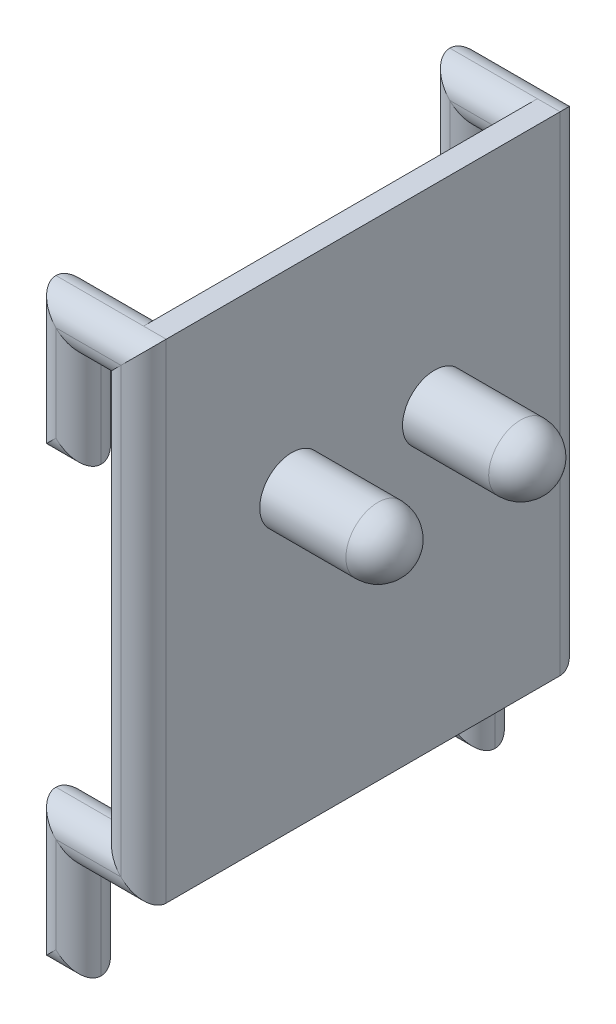
from build123d import *

# Parameters (mm, degrees)
EXTRU_MINCE1_DEPTH         = 2.3
CONG_1_R                   = 2.3
ESQUISSE2_W                = 40
ESQUISSE2_H                = 49.6
BOSS_EXTRU_1_DEPTH         = 2.3
R_P_TITION_LIN_AIRE1_COUNT = 2
R_P_TITION_LIN_AIRE1_PITCH = 40
CONG_2_R                   = 2.3
ESQUISSE3_R                = 3.25
BOSS_EXTRU_2_DEPTH         = 12
CONG_3_R                   = 3.25


with BuildPart() as part:
    # Esquisse1 → Extru.-Mince1 (new, symmetric)
    with BuildSketch(Plane.XY):
        Polygon((-4.3, -57), (-4.3, -47.3), (2.3, -47.3), (2.3, 2.3), (-8.9, 2.3), (-8.9, -12), (-4.3, -12), (-4.3, -2.3), (-2.3, -2.3), (-2.3, -42.7), (-8.9, -42.7), (-8.9, -57), align=None)
    extru_mince1 = extrude(amount=EXTRU_MINCE1_DEPTH, both=True)

    # Congé1
    cong_1_edges = [part.edges().sort_by_distance(p)[0] for p in [
        (-6.6, -57, -2.3),
        (-4.3, -52.15, -2.3),
        (-1, -47.3, -2.3),
        (2.3, -22.5, -2.3),
        (-3.3, 2.3, -2.3),
        (-8.9, -4.85, -2.3),
        (-6.6, -12, -2.3),
        (-4.3, -7.15, -2.3),
        (-3.3, -2.3, -2.3),
        (-2.3, -22.5, -2.3),
        (-5.6, -42.7, -2.3),
        (-8.9, -49.85, -2.3),
        (-5.6, -42.7, 2.3),
        (-2.3, -22.5, 2.3),
        (-3.3, -2.3, 2.3),
        (-4.3, -7.15, 2.3),
        (-6.6, -12, 2.3),
        (-8.9, -4.85, 2.3),
        (-3.3, 2.3, 2.3),
        (2.3, -22.5, 2.3),
        (-1, -47.3, 2.3),
        (-4.3, -52.15, 2.3),
        (-6.6, -57, 2.3),
        (-8.9, -49.85, 2.3),
    ]]
    fillet(cong_1_edges, radius=CONG_1_R - 0.0001)  # a hair under: the kernel refuses the full size

    # Esquisse2 → Boss.-Extru.1 (add)
    with BuildSketch(Plane(origin=(0, 0, 0), x_dir=(0, 0, -1), z_dir=(1, 0, 0))):
        with Locations((-20, -22.5)):
            Rectangle(ESQUISSE2_W, ESQUISSE2_H)
    extrude(amount=BOSS_EXTRU_1_DEPTH)

    # Répétition linéaire1: Extru.-Mince1 ×2
    with Locations(*[(0, 0, i * R_P_TITION_LIN_AIRE1_PITCH) for i in range(1, R_P_TITION_LIN_AIRE1_COUNT)]):
        add(extru_mince1)

    # Congé2
    cong_2_edges = [part.edges().sort_by_distance(p)[0] for p in [
        (-5.6, -42.7, 42.3),
        (-2.3, -22.5, 42.3),
        (-3.3, -2.3, 42.3),
        (-4.3, -7.15, 42.3),
        (-6.6, -12, 42.3),
        (-8.9, -4.85, 42.3),
        (-3.3, 2.3, 42.3),
        (2.3, -22.5, 42.3),
        (-1, -47.3, 42.3),
        (-4.3, -52.15, 42.3),
        (-6.6, -57, 42.3),
        (-8.9, -49.85, 42.3),
        (-2.15, -47.3, 37.7),
        (-4.3, -52.15, 37.7),
        (-6.6, -57, 37.7),
        (-8.9, -49.85, 37.7),
        (-5.6, -42.7, 37.7),
        (-2.3, -22.5, 37.7),
        (-3.3, -2.3, 37.7),
        (-4.3, -7.15, 37.7),
        (-6.6, -12, 37.7),
        (-8.9, -4.85, 37.7),
        (-4.45, 2.3, 37.7),
    ]]
    fillet(cong_2_edges, radius=CONG_2_R - 0.0001)  # a hair under: the kernel refuses the full size

    # Esquisse3 → Boss.-Extru.2 (add)
    with BuildSketch(Plane(origin=(2.3, 0, 0), x_dir=(0, 0, -1), z_dir=(1, 0, 0))):
        with Locations((-27.25, -17.3)):
            Circle(ESQUISSE3_R)
        with Locations((-12.75, -17.3)):
            Circle(ESQUISSE3_R)
    extrude(amount=BOSS_EXTRU_2_DEPTH)

    # Congé3
    cong_3_edges = [part.edges().sort_by_distance(p)[0] for p in [
        (14.3, -17.3, 30.5),
        (14.3, -17.3, 16),
    ]]
    fillet(cong_3_edges, radius=CONG_3_R)


solid = part.part
